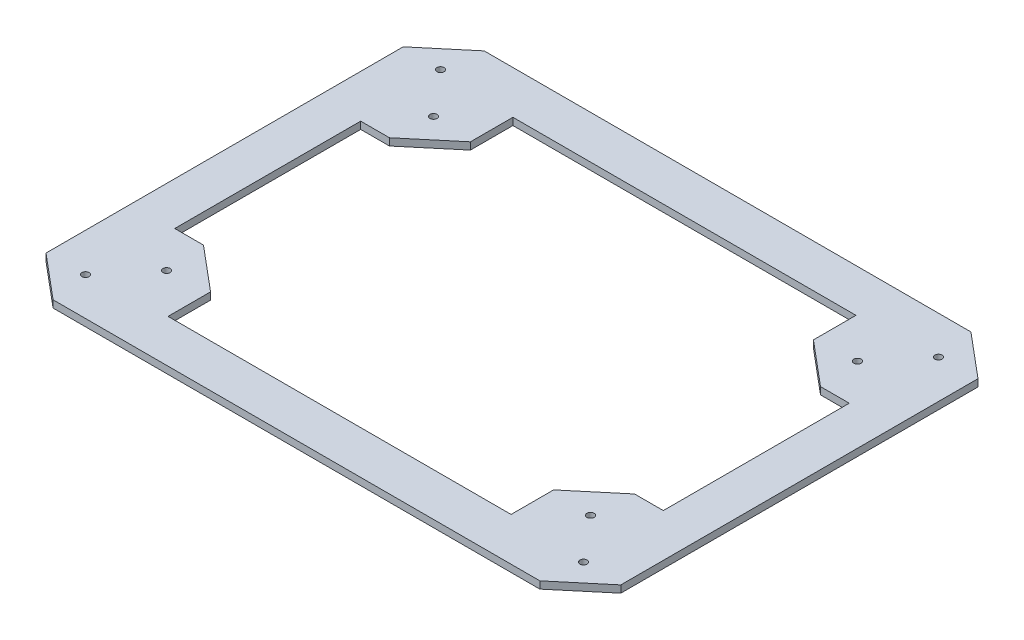
from build123d import *

# Parameters (mm, degrees)
BOSS_EXTRUDE1_DEPTH = 3.175
SKETCH2_R           = 1.5875
CUT_EXTRUDE1_DEPTH  = 159.781746826


with BuildPart() as part:
    # Sketch1 → Boss-Extrude1 (new body)
    with BuildSketch(Plane(origin=(0, 0, 0), x_dir=(1, 0, 0), z_dir=(0, 1, 0))):
        Polygon((-107.542471145, 95.25), (-127, 78.923194714), (-127, -78.923194714), (-107.542471145, -95.25), (107.542471145, -95.25), (127, -78.923194714), (127, 78.923194714), (107.542471145, 95.25), align=None)
        Polygon((-107.95, -41.085018149), (-107.95, 41.085018149), (-95.25, 41.085018149), (-75.792471145, 57.411823435), (-75.792471145, 76.2), (75.792471145, 76.2), (75.792471145, 57.411823435), (95.25, 41.085018149), (107.95, 41.085018149), (107.95, -41.085018149), (95.25, -41.085018149), (75.792471145, -57.411823435), (75.792471145, -76.2), (-75.792471145, -76.2), (-75.792471145, -57.411823435), (-95.25, -41.085018149), align=None, mode=Mode.SUBTRACT)
    extrude(amount=BOSS_EXTRUDE1_DEPTH)

    # Sketch2 → Cut-Extrude1 (cut, through all)
    with BuildSketch(Plane(origin=(0, 3.175, 0), x_dir=(1, 0, 0), z_dir=(0, 1, 0))):
        with Locations((-93.684638215, 58.97718522)):
            Circle(SKETCH2_R)
        with Locations((-110.011443501, 78.434714075)):
            Circle(SKETCH2_R)
        with Locations((110.011443501, 78.434714075)):
            Circle(SKETCH2_R)
        with Locations((93.684638215, 58.97718522)):
            Circle(SKETCH2_R)
        with Locations((110.011443501, -78.434714075)):
            Circle(SKETCH2_R)
        with Locations((93.684638215, -58.97718522)):
            Circle(SKETCH2_R)
        with Locations((-110.011443501, -78.434714075)):
            Circle(SKETCH2_R)
        with Locations((-93.684638215, -58.97718522)):
            Circle(SKETCH2_R)
    extrude(amount=-CUT_EXTRUDE1_DEPTH, mode=Mode.SUBTRACT)


solid = part.part
